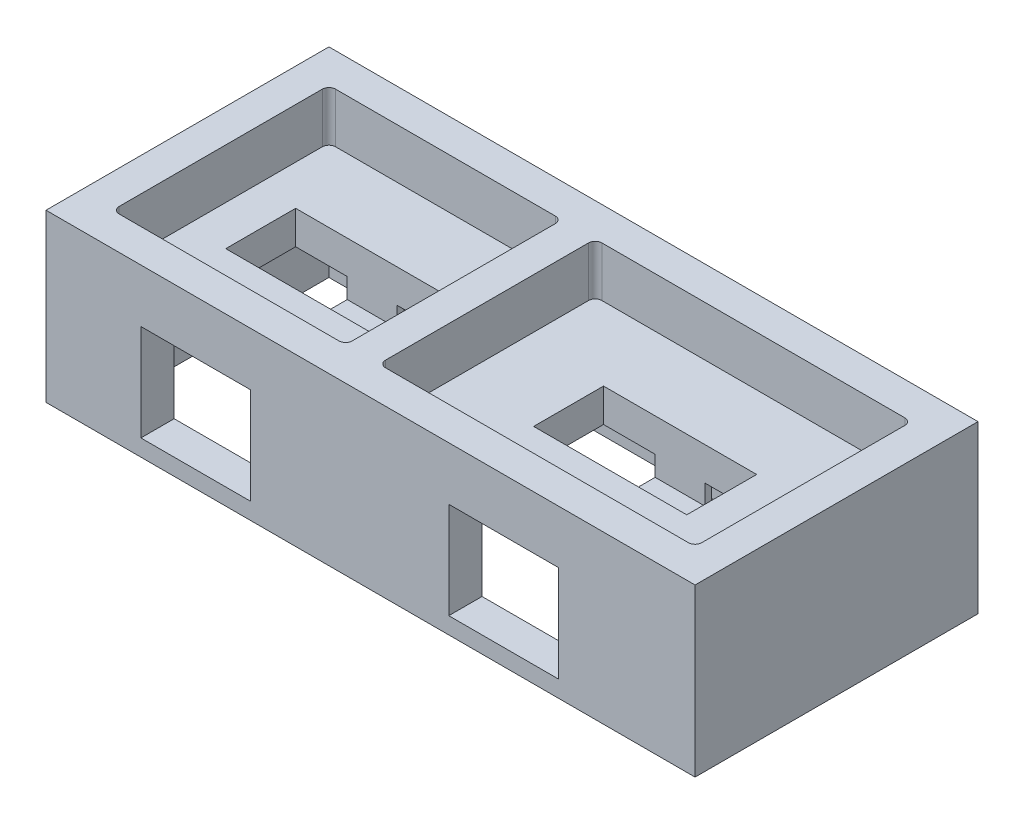
from build123d import *

# Parameters (mm, degrees)
SKETCH2_W            = 195
SKETCH2_H            = 180
BOSS_EXTRUDE1_DEPTH  = 50
CUT_EXTRUDE1_DEPTH   = 15
BOSS_EXTRUDE4_DEPTH  = 50
SKETCH14_W           = 70
SKETCH14_H           = 65
SKETCH14_W_2         = 95
BOSS_EXTRUDE8_DEPTH  = 35
SHELL2_OUTLINE_W     = 175
SHELL2_OUTLINE_H     = 65
SHELL2_DEPTH         = 75
SHELL2_2_OUTLINE_W   = 175
SHELL2_2_OUTLINE_H   = 95
SHELL2_2_DEPTH       = 25
SHELL2_START         = 25
SHELL2_3_DEPTH       = 15
SKETCH15_W           = 46
SKETCH15_H           = 21
CUT_EXTRUDE2_DEPTH   = 30
SKETCH16_W           = 46
SKETCH16_H           = 21
CUT_EXTRUDE3_DEPTH   = 30
SKETCH17_W           = 7.5
SKETCH17_H           = 8
BOSS_EXTRUDE9_DEPTH  = 2
SKETCH18_W           = 15
SKETCH18_H           = 2
BOSS_EXTRUDE10_DEPTH = 15
SKETCH19_W           = 33
SKETCH19_H           = 29
CUT_EXTRUDE14_DEPTH  = 10


# Read off the part's stored shape, not the designer's step: Shell2
with BuildPart() as part:
    # Sketch2 → Boss-Extrude1 (new body)
    with BuildSketch(Plane(origin=(0, 0, 0), x_dir=(1, 0, 0), z_dir=(0, 1, 0))):
        with Locations((97.5, 90)):
            Rectangle(SKETCH2_W, SKETCH2_H)
    extrude(amount=BOSS_EXTRUDE1_DEPTH)

    # Sketch3 → Cut-Extrude1 (cut)
    with BuildSketch(Plane(origin=(0, 50, 0), x_dir=(1, 0, 0), z_dir=(0, 1, 0))):
        with BuildLine():
            Line((90, 12), (90, 73))
            ThreePointArc((90, 73), (90.585786438, 74.414213562), (92, 75))
            Line((92, 75), (183, 75))
            ThreePointArc((183, 75), (184.414213562, 74.414213562), (185, 73))
            Line((185, 73), (185, 12))
            ThreePointArc((185, 12), (184.414213562, 10.585786438), (183, 10))
            Line((183, 10), (92, 10))
            ThreePointArc((92, 10), (90.585786438, 10.585786438), (90, 12))
        make_face()
        with BuildLine():
            Line((12, 10), (78, 10))
            ThreePointArc((78, 10), (79.414213562, 10.585786438), (80, 12))
            Line((80, 12), (80, 73))
            ThreePointArc((80, 73), (79.414213562, 74.414213562), (78, 75))
            Line((78, 75), (12, 75))
            ThreePointArc((12, 75), (10.585786438, 74.414213562), (10, 73))
            Line((10, 73), (10, 12))
            ThreePointArc((10, 12), (10.585786438, 10.585786438), (12, 10))
        make_face()
    extrude(amount=-CUT_EXTRUDE1_DEPTH, mode=Mode.SUBTRACT)

    # Sketch6 → Boss-Extrude4 (add)
    with BuildSketch(Plane(origin=(0, 50, 0), x_dir=(1, 0, 0), z_dir=(0, 1, 0))):
        Polygon((0, 180), (185, 180), (195, 180), (195, 95), (185, 95), (0, 95), align=None)
        with BuildLine():
            Line((185, 168), (185, 107))
            ThreePointArc((185, 107), (184.414213562, 105.585786438), (183, 105))
            Line((183, 105), (92, 105))
            ThreePointArc((92, 105), (90.585786438, 105.585786438), (90, 107))
            Line((90, 107), (90, 168))
            ThreePointArc((90, 168), (90.585786438, 169.414213562), (92, 170))
            Line((92, 170), (183, 170))
            ThreePointArc((183, 170), (184.414213562, 169.414213562), (185, 168))
        make_face(mode=Mode.SUBTRACT)
        with BuildLine():
            Line((80, 107), (80, 168))
            ThreePointArc((80, 168), (79.414213562, 169.414213562), (78, 170))
            Line((78, 170), (12, 170))
            ThreePointArc((12, 170), (10.585786438, 169.414213562), (10, 168))
            Line((10, 168), (10, 107))
            ThreePointArc((10, 107), (10.585786438, 105.585786438), (12, 105))
            Line((12, 105), (78, 105))
            ThreePointArc((78, 105), (79.414213562, 105.585786438), (80, 107))
        make_face(mode=Mode.SUBTRACT)
    extrude(amount=BOSS_EXTRUDE4_DEPTH)

    # Sketch14 → Boss-Extrude8 (add)
    with BuildSketch(Plane(origin=(0, 50, 0), x_dir=(1, 0, 0), z_dir=(0, 1, 0))):
        with Locations((45, 137.5)):
            Rectangle(SKETCH14_W, SKETCH14_H)
        with Locations((137.5, 137.5)):
            Rectangle(SKETCH14_W_2, SKETCH14_H)
    extrude(amount=BOSS_EXTRUDE8_DEPTH)

    # Shell2 outline → Shell2 (cut)
    with BuildSketch(Plane(origin=(0, 0, 0), x_dir=(1, 0, 0), z_dir=(0, 1, 0))):
        with Locations((97.5, 137.5)):
            Rectangle(SHELL2_OUTLINE_W, SHELL2_OUTLINE_H)
    extrude(amount=SHELL2_DEPTH, mode=Mode.SUBTRACT)

    # Shell2 2 outline → Shell2 2 (cut)
    with BuildSketch(Plane(origin=(0, 0, 0), x_dir=(1, 0, 0), z_dir=(0, 1, 0))):
        with Locations((97.5, 57.5)):
            Rectangle(SHELL2_2_OUTLINE_W, SHELL2_2_OUTLINE_H)
    extrude(amount=SHELL2_2_DEPTH, mode=Mode.SUBTRACT)

    # Shell2 3 outline → Shell2 3 (cut)
    with BuildSketch(Plane(origin=(0, 0, 0), x_dir=(1, 0, 0), z_dir=(0, 1, 0)).offset(SHELL2_START)):
        with BuildLine():
            Line((10, 105), (10, 84.832159566))
            ThreePointArc((10, 84.832159566), (10.996484877, 84.957966273), (12, 85))
            Line((12, 85), (78, 85))
            ThreePointArc((78, 85), (81.676851089, 84.422817781), (85, 82.746794345))
            ThreePointArc((85, 82.746794345), (88.323148911, 84.422817781), (92, 85))
            Line((92, 85), (183, 85))
            ThreePointArc((183, 85), (184.003515123, 84.957966273), (185, 84.832159566))
            Line((185, 84.832159566), (185, 105))
            Line((185, 105), (10, 105))
        make_face()
    extrude(amount=SHELL2_3_DEPTH, mode=Mode.SUBTRACT)

    # SurfaceCut1
    split(bisect_by=Plane(origin=(0, 50, 0), x_dir=(1, 0, 0), z_dir=(0, 1, 0)), keep=Keep.TOP)

    # Sketch15 → Cut-Extrude2 (cut)
    with BuildSketch(Plane(origin=(0, 85, 0), x_dir=(1, 0, 0), z_dir=(0, 1, 0))):
        with Locations((45, 137.5)):
            Rectangle(SKETCH15_W, SKETCH15_H)
    extrude(amount=-CUT_EXTRUDE2_DEPTH, mode=Mode.SUBTRACT)

    # Sketch16 → Cut-Extrude3 (cut)
    with BuildSketch(Plane(origin=(0, 85, 0), x_dir=(1, 0, 0), z_dir=(0, 1, 0))):
        with Locations((137.5, 137.5)):
            Rectangle(SKETCH16_W, SKETCH16_H)
    extrude(amount=-CUT_EXTRUDE3_DEPTH, mode=Mode.SUBTRACT)

    # Sketch17 → Boss-Extrude9 (add)
    with BuildSketch(Plane.XY.offset(-148)):
        with Locations((41.25, 71)):
            Rectangle(SKETCH17_W, SKETCH17_H)
        with Locations((48.75, 71)):
            Rectangle(SKETCH17_W, SKETCH17_H)
    boss_extrude9 = extrude(amount=-BOSS_EXTRUDE9_DEPTH)

    # Sketch18 → Boss-Extrude10 (add)
    with BuildSketch(Plane.XY.offset(-148)):
        with Locations((45, 68)):
            Rectangle(SKETCH18_W, SKETCH18_H)
    boss_extrude10 = extrude(amount=BOSS_EXTRUDE10_DEPTH)

    # Mirror1: Boss-Extrude9, Boss-Extrude10 across plane
    add(boss_extrude9.mirror(Plane.ZY.offset(-91.25)))
    add(boss_extrude10.mirror(Plane.ZY.offset(-91.25)))

    # Sketch19 → Cut-Extrude14 (cut)
    with BuildSketch(Plane.XY.offset(-95)):
        with Locations((45, 69.5)):
            Rectangle(SKETCH19_W, SKETCH19_H)
        with Locations((137.5, 69.5)):
            Rectangle(SKETCH19_W, SKETCH19_H)
    extrude(amount=-CUT_EXTRUDE14_DEPTH, mode=Mode.SUBTRACT)


solid = part.part
